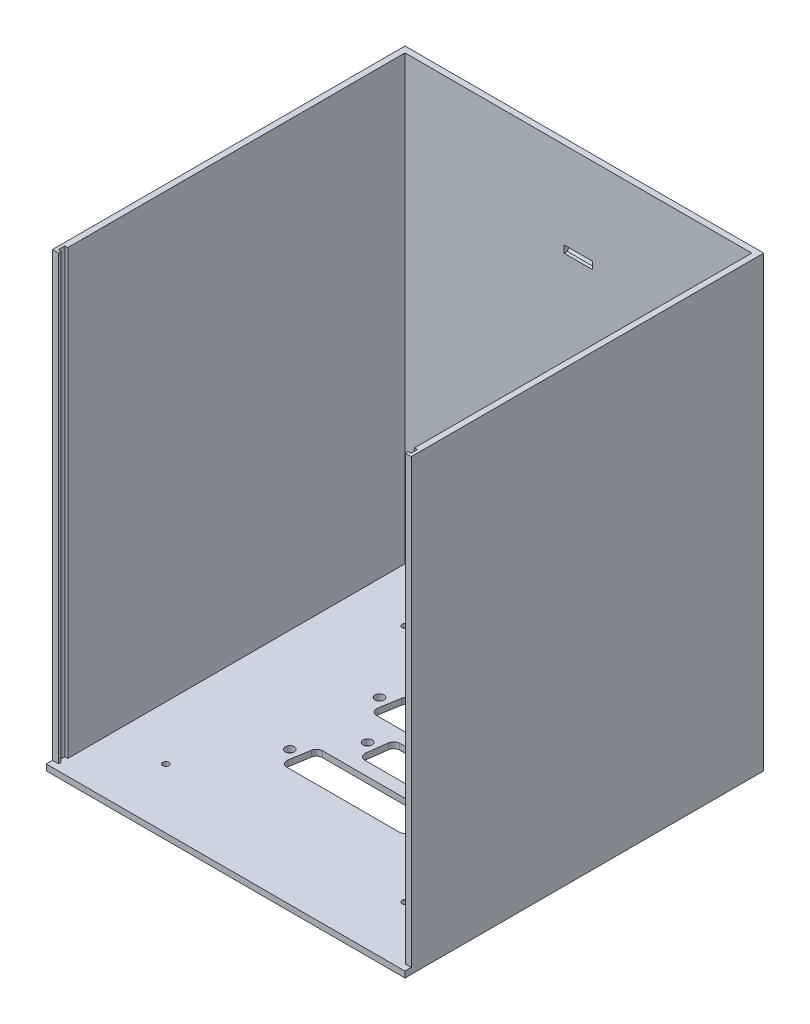
from build123d import *

# Parameters (mm, degrees)
SKETCH1_W             = 120
SKETCH1_H             = 120
MAIN_BODY_DEPTH       = 150
SKETCH11_W            = 116
SKETCH11_H            = 118
HOLLOW_DEPTH          = 148
SKETCH12_W            = 2
SKETCH12_H            = 2.1
LID_CUT_DEPTH         = 148
SKETCH13_W            = 1
SKETCH13_H            = 2.2
RAIL_CUT_DEPTH        = 148
MAIN_PCB_HOLES_REACH  = 174.337
SKETCH2_R             = 1
CONNECTOR_SLOTS_REACH = 174.337
SKETCH4_R             = 1.5
CUT_EXTRUDE1_DEPTH    = 4.75


with BuildPart() as part:
    # Sketch1 → Main-Body (new body)
    with BuildSketch(Plane(origin=(0, 0, 0), x_dir=(1, 0, 0), z_dir=(0, 1, 0))):
        Rectangle(SKETCH1_W, SKETCH1_H)
    extrude(amount=MAIN_BODY_DEPTH)

    # Sketch11 → Hollow (cut)
    with BuildSketch(Plane(origin=(0, 150, 0), x_dir=(1, 0, 0), z_dir=(0, 1, 0))):
        with Locations((0, -1)):
            Rectangle(SKETCH11_W, SKETCH11_H)
    extrude(amount=-HOLLOW_DEPTH, mode=Mode.SUBTRACT)

    # Sketch12 → Lid-Cut (cut)
    with BuildSketch(Plane(origin=(0, 150, 0), x_dir=(1, 0, 0), z_dir=(0, 1, 0))):
        with Locations((-59, -58.95)):
            Rectangle(SKETCH12_W, SKETCH12_H)
    lid_cut = extrude(amount=-LID_CUT_DEPTH, mode=Mode.SUBTRACT)

    # Mirror-Lid-Cut: Lid-Cut across plane
    add(lid_cut.mirror(Plane(origin=(0, 0, 0), x_dir=(0, 0, 1), z_dir=(1, 0, 0))), mode=Mode.SUBTRACT)

    # Sketch13 → Rail-Cut (cut)
    with BuildSketch(Plane(origin=(0, 150, 0), x_dir=(1, 0, 0), z_dir=(0, 1, 0))):
        with Locations((-58.5, -55.9)):
            Rectangle(SKETCH13_W, SKETCH13_H)
    rail_cut = extrude(amount=-RAIL_CUT_DEPTH, mode=Mode.SUBTRACT)

    # Mirror-Rail-Cut: Rail-Cut across plane
    add(rail_cut.mirror(Plane(origin=(0, 0, 0), x_dir=(0, 0, 1), z_dir=(1, 0, 0))), mode=Mode.SUBTRACT)

    # Sketch2 → Main-PCB-Holes (cut, up to next)
    with BuildSketch(Plane.XZ, mode=Mode.PRIVATE) as main_pcb_holes_sk1:
        with Locations((-40, 40)):
            Circle(SKETCH2_R)
    main_pcb_holes_tool1 = extrude(main_pcb_holes_sk1.sketch, amount=-MAIN_PCB_HOLES_REACH, mode=Mode.PRIVATE) & part.part
    # Sketch2 → Main-PCB-Holes (cut, up to next)
    with BuildSketch(Plane.XZ, mode=Mode.PRIVATE) as main_pcb_holes_sk2:
        with Locations((40, 40)):
            Circle(SKETCH2_R)
    main_pcb_holes_tool2 = extrude(main_pcb_holes_sk2.sketch, amount=-MAIN_PCB_HOLES_REACH, mode=Mode.PRIVATE) & part.part
    # Sketch2 → Main-PCB-Holes (cut, up to next)
    with BuildSketch(Plane.XZ, mode=Mode.PRIVATE) as main_pcb_holes_sk3:
        with Locations((40, -40)):
            Circle(SKETCH2_R)
    main_pcb_holes_tool3 = extrude(main_pcb_holes_sk3.sketch, amount=-MAIN_PCB_HOLES_REACH, mode=Mode.PRIVATE) & part.part
    # Sketch2 → Main-PCB-Holes (cut, up to next)
    with BuildSketch(Plane.XZ, mode=Mode.PRIVATE) as main_pcb_holes_sk4:
        with Locations((-40, -40)):
            Circle(SKETCH2_R)
    main_pcb_holes_tool4 = extrude(main_pcb_holes_sk4.sketch, amount=-MAIN_PCB_HOLES_REACH, mode=Mode.PRIVATE) & part.part
    add(main_pcb_holes_tool1.solids().sort_by_distance((-40, 0, 40))[0], mode=Mode.SUBTRACT)
    add(main_pcb_holes_tool2.solids().sort_by_distance((40, 0, 40))[0], mode=Mode.SUBTRACT)
    add(main_pcb_holes_tool3.solids().sort_by_distance((40, 0, -40))[0], mode=Mode.SUBTRACT)
    add(main_pcb_holes_tool4.solids().sort_by_distance((-40, 0, -40))[0], mode=Mode.SUBTRACT)

    # Sketch4 → Connector-Slots (cut, up to next)
    with BuildSketch(Plane.XZ, mode=Mode.PRIVATE) as connector_slots_sk1:
        with Locations((-12.5, 0)):
            Circle(SKETCH4_R)
    connector_slots_tool1 = extrude(connector_slots_sk1.sketch, amount=-CONNECTOR_SLOTS_REACH, mode=Mode.PRIVATE) & part.part
    # Sketch4 → Connector-Slots (cut, up to next)
    with BuildSketch(Plane.XZ, mode=Mode.PRIVATE) as connector_slots_sk2:
        with Locations((12.5, 0)):
            Circle(SKETCH4_R)
    connector_slots_tool2 = extrude(connector_slots_sk2.sketch, amount=-CONNECTOR_SLOTS_REACH, mode=Mode.PRIVATE) & part.part
    # Sketch4 → Connector-Slots (cut, up to next)
    with BuildSketch(Plane.XZ, mode=Mode.PRIVATE) as connector_slots_sk3:
        with Locations((-23.52, -15)):
            Circle(SKETCH4_R)
    connector_slots_tool3 = extrude(connector_slots_sk3.sketch, amount=-CONNECTOR_SLOTS_REACH, mode=Mode.PRIVATE) & part.part
    # Sketch4 → Connector-Slots (cut, up to next)
    with BuildSketch(Plane.XZ, mode=Mode.PRIVATE) as connector_slots_sk4:
        with Locations((23.52, -15)):
            Circle(SKETCH4_R)
    connector_slots_tool4 = extrude(connector_slots_sk4.sketch, amount=-CONNECTOR_SLOTS_REACH, mode=Mode.PRIVATE) & part.part
    # Sketch4 → Connector-Slots (cut, up to next)
    with BuildSketch(Plane.XZ, mode=Mode.PRIVATE) as connector_slots_sk5:
        with Locations((-23.52, 15)):
            Circle(SKETCH4_R)
    connector_slots_tool5 = extrude(connector_slots_sk5.sketch, amount=-CONNECTOR_SLOTS_REACH, mode=Mode.PRIVATE) & part.part
    # Sketch4 → Connector-Slots (cut, up to next)
    with BuildSketch(Plane.XZ, mode=Mode.PRIVATE) as connector_slots_sk6:
        with Locations((23.52, 15)):
            Circle(SKETCH4_R)
    connector_slots_tool6 = extrude(connector_slots_sk6.sketch, amount=-CONNECTOR_SLOTS_REACH, mode=Mode.PRIVATE) & part.part
    # Sketch4 → Connector-Slots (cut, up to next)
    with BuildSketch(Plane.XZ, mode=Mode.PRIVATE) as connector_slots_sk7:
        with BuildLine():
            Line((-6.891594987, -5.117891943), (6.891594987, -5.117891943))
            ThreePointArc((6.891594987, -5.117891943), (8.211781315, -4.620259427), (8.875, -3.375))
            Line((8.875, -3.375), (9.75, 3.375))
            ThreePointArc((9.75, 3.375), (9.268962471, 4.952294386), (7.766594987, 5.632108057))
            Line((7.766594987, 5.632108057), (-7.766594987, 5.632108057))
            ThreePointArc((-7.766594987, 5.632108057), (-9.268962471, 4.952294386), (-9.75, 3.375))
            Line((-9.75, 3.375), (-8.875, -3.375))
            ThreePointArc((-8.875, -3.375), (-8.211781315, -4.620259427), (-6.891594987, -5.117891943))
        make_face()
    connector_slots_tool7 = extrude(connector_slots_sk7.sketch, amount=-CONNECTOR_SLOTS_REACH, mode=Mode.PRIVATE) & part.part
    # Sketch4 → Connector-Slots (cut, up to next)
    with BuildSketch(Plane.XZ, mode=Mode.PRIVATE) as connector_slots_sk8:
        with BuildLine():
            Line((-17.652212152, -20.046202025), (17.652212152, -20.046202025))
            ThreePointArc((17.652212152, -20.046202025), (18.944961945, -19.57224199), (19.625, -18.375))
            Line((19.625, -18.375), (20.75, -11.625))
            ThreePointArc((20.75, -11.625), (20.303252117, -10.003452233), (18.777212152, -9.296202025))
            Line((18.777212152, -9.296202025), (-18.777212152, -9.296202025))
            ThreePointArc((-18.777212152, -9.296202025), (-20.303252117, -10.003452233), (-20.75, -11.625))
            Line((-20.75, -11.625), (-19.625, -18.375))
            ThreePointArc((-19.625, -18.375), (-18.944961945, -19.57224199), (-17.652212152, -20.046202025))
        make_face()
    connector_slots_tool8 = extrude(connector_slots_sk8.sketch, amount=-CONNECTOR_SLOTS_REACH, mode=Mode.PRIVATE) & part.part
    # Sketch4 → Connector-Slots (cut, up to next)
    with BuildSketch(Plane.XZ, mode=Mode.PRIVATE) as connector_slots_sk9:
        with BuildLine():
            Line((-17.652212152, 9.953797975), (17.652212152, 9.953797975))
            ThreePointArc((17.652212152, 9.953797975), (18.944961945, 10.42775801), (19.625, 11.625))
            Line((19.625, 11.625), (20.75, 18.375))
            ThreePointArc((20.75, 18.375), (20.303252117, 19.996547767), (18.777212152, 20.703797975))
            Line((18.777212152, 20.703797975), (-18.777212152, 20.703797975))
            ThreePointArc((-18.777212152, 20.703797975), (-20.303252117, 19.996547767), (-20.75, 18.375))
            Line((-20.75, 18.375), (-19.625, 11.625))
            ThreePointArc((-19.625, 11.625), (-18.944961945, 10.42775801), (-17.652212152, 9.953797975))
        make_face()
    connector_slots_tool9 = extrude(connector_slots_sk9.sketch, amount=-CONNECTOR_SLOTS_REACH, mode=Mode.PRIVATE) & part.part
    add(connector_slots_tool1.solids().sort_by_distance((-12.5, 0, 0))[0], mode=Mode.SUBTRACT)
    add(connector_slots_tool2.solids().sort_by_distance((12.5, 0, 0))[0], mode=Mode.SUBTRACT)
    add(connector_slots_tool3.solids().sort_by_distance((-23.52, 0, -15))[0], mode=Mode.SUBTRACT)
    add(connector_slots_tool4.solids().sort_by_distance((23.52, 0, -15))[0], mode=Mode.SUBTRACT)
    add(connector_slots_tool5.solids().sort_by_distance((-23.52, 0, 15))[0], mode=Mode.SUBTRACT)
    add(connector_slots_tool6.solids().sort_by_distance((23.52, 0, 15))[0], mode=Mode.SUBTRACT)
    add(connector_slots_tool7.solids().sort_by_distance((0, 0, 0.368259))[0], mode=Mode.SUBTRACT)
    add(connector_slots_tool8.solids().sort_by_distance((0, 0, -14.605881))[0], mode=Mode.SUBTRACT)
    add(connector_slots_tool9.solids().sort_by_distance((0, 0, 15.394119))[0], mode=Mode.SUBTRACT)

    # Sketch14 → Cut-Extrude1 (cut, symmetric)
    with BuildSketch(Plane(origin=(0, 0, 0), x_dir=(0, 0, -1), z_dir=(1, 0, 0))):
        Polygon((58, 121), (60, 121), (60, 120.88), (60, 119.88), (59.82055535, 119.88), (59.07, 118.58), (58, 118.58), align=None)
    extrude(amount=CUT_EXTRUDE1_DEPTH, both=True, mode=Mode.SUBTRACT)


solid = part.part
